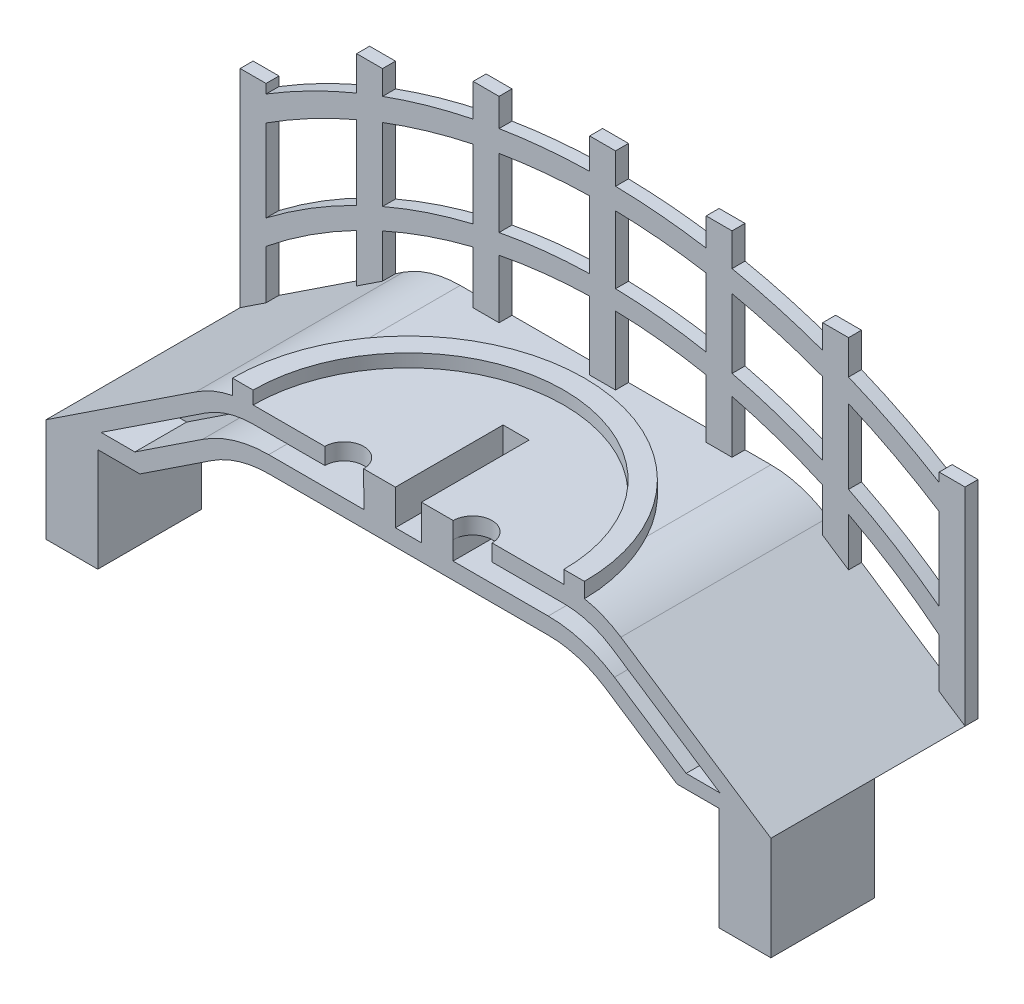
from build123d import *

# Parameters (mm, degrees)
BOSS_EXTRUDE1_DEPTH      = 12.7
BOSS_EXTRUDE2_DEPTH      = 0.79375
SKETCH5_7_W              = 1.5875
SKETCH5_7_H              = 15.875
SKETCH5_7_H_2            = 12.7
BOSS_EXTRUDE6_DEPTH      = 0.79375
BOSS_EXTRUDE7_DEPTH      = 0.79375
CUT_EXTRUDE1_DEPTH       = 9.525
SKETCH8_W                = 1.6002
SKETCH8_H                = 6.604
CUT_EXTRUDE2_DEPTH       = 1.397
BOSS_EXTRUDE8_DEPTH      = 1.397
BOSS_EXTRUDE9_DEPTH      = 0.79375
BOSS_EXTRUDE9_DEPTH_BACK = 0.254
SKETCH12_W               = 3.175
SKETCH12_H               = 6.35
BOSS_EXTRUDE10_DEPTH     = 6.35
CUT_EXTRUDE3_DEPTH       = 3.175


with BuildPart() as part:
    # Sketch5 → Boss-Extrude1 (new body)
    with BuildSketch(Plane.XY):
        with BuildLine():
            Line((5.757097876, 0), (10.152663822, 2.905998883))
            ThreePointArc((10.152663822, 2.905998883), (11.826216975, 3.690024401), (13.654645278, 3.958959532))
            Line((13.654645278, 3.958959532), (30.795354722, 3.958959532))
            ThreePointArc((30.795354722, 3.958959532), (32.623783025, 3.690024401), (34.297336178, 2.905998883))
            Line((34.297336178, 2.905998883), (38.692902124, 0))
            Line((38.692902124, 0), (44.45, 0))
            Line((44.45, 0), (35.251981456, 6.080998883))
            ThreePointArc((35.251981456, 6.080998883), (33.578428304, 6.865024401), (31.75, 7.133959532))
            Line((31.75, 7.133959532), (12.7, 7.133959532))
            ThreePointArc((12.7, 7.133959532), (10.871571696, 6.865024401), (9.198018544, 6.080998883))
            Line((9.198018544, 6.080998883), (0, 0))
            Line((0, 0), (5.757097876, 0))
        make_face()
    extrude(amount=BOSS_EXTRUDE1_DEPTH)



with BuildPart() as body_2:
    # Sketch5<4> → Boss-Extrude2 (new body)
    with BuildSketch(Plane.XY):
        with BuildLine():
            Line((0, 11.1125), (0, 9.525))
            ThreePointArc((0, 9.525), (22.225, 16.658959532), (44.45, 9.525))
            Line((44.45, 9.525), (44.45, 11.1125))
            ThreePointArc((44.45, 11.1125), (22.225, 17.96069625), (0, 11.1125))
        make_face()
    extrude(amount=BOSS_EXTRUDE2_DEPTH)

    # Sketch5<7> → Boss-Extrude6 (add)
    with BuildSketch(Plane.XY):
        with Locations((7.9375, 9.122908395)):
            Rectangle(SKETCH5_7_W, SKETCH5_7_H)
        Polygon((0, 0), (1.5875, 1.049528839), (1.5875, 12.7), (0, 12.7), align=None)
        with Locations((15.08125, 11.222301738)):
            Rectangle(SKETCH5_7_W, SKETCH5_7_H)
        with Locations((22.225, 11.896459532)):
            Rectangle(SKETCH5_7_W, SKETCH5_7_H)
        with BuildLine():
            Line((28.575, 3.284801738), (30.1625, 3.284801738))
            Line((30.1625, 3.284801738), (30.1625, 15.824904204))
            ThreePointArc((30.1625, 15.824904204), (29.370349797, 15.984497043), (28.575, 16.127292418))
            Line((28.575, 16.127292418), (28.575, 3.284801738))
        make_face()
        with BuildLine():
            Line((28.575, 19.159801738), (28.575, 17.446790716))
            ThreePointArc((28.575, 17.446790716), (29.370242514, 17.308866955), (30.1625, 17.154718663))
            Line((30.1625, 17.154718663), (30.1625, 19.159801738))
            Line((30.1625, 19.159801738), (28.575, 19.159801738))
        make_face()
        with Locations((36.5125, 9.122908395)):
            Rectangle(SKETCH5_7_W, SKETCH5_7_H)
        with Locations((43.65625, 6.35)):
            Rectangle(SKETCH5_7_W, SKETCH5_7_H_2)
    extrude(amount=BOSS_EXTRUDE6_DEPTH)


with BuildPart() as part_1:
    add(part.part)

    add(body_2.part)  # Boss-Extrude7 merges body 2
    # Sketch6 → Boss-Extrude7 (add)
    with BuildSketch(Plane(origin=(0, 0, 0), x_dir=(-1, 0, 0), z_dir=(0, 0, -1))):
        with BuildLine():
            Line((-44.45, 4.270423014), (-44.45, 2.682923014))
            ThreePointArc((-44.45, 2.682923014), (-22.225, 11.337252313), (0, 2.682923014))
            Line((0, 2.682923014), (0, 4.270423014))
            ThreePointArc((0, 4.270423014), (-22.225, 12.523643082), (-44.45, 4.270423014))
        make_face()
    extrude(amount=-BOSS_EXTRUDE7_DEPTH)

    # Sketch7 → Cut-Extrude1 (cut)
    with BuildSketch(Plane.XY.offset(12.7)):
        Polygon((31.75, 6.117959532), (12.7, 6.117959532), (12.7, 4.974959532), (13.654645278, 4.974959532), (30.795354722, 4.974959532), (31.75, 4.974959532), align=None)
    extrude(amount=-CUT_EXTRUDE1_DEPTH, mode=Mode.SUBTRACT)

    # Sketch8 → Cut-Extrude2 (cut)
    with BuildSketch(Plane(origin=(0, 7.133959532, 0), x_dir=(1, 0, 0), z_dir=(0, 1, 0))):
        with BuildLine():
            Line((17.097375, -12.7), (19.478625, -12.7))
            ThreePointArc((19.478625, -12.7), (18.288, -11.509375), (17.097375, -12.7))
        make_face()
        with BuildLine():
            ThreePointArc((27.352625, -12.7), (26.162, -11.509375), (24.971375, -12.7))
            Line((24.971375, -12.7), (27.352625, -12.7))
        make_face()
        with Locations((22.225, -9.398)):
            Rectangle(SKETCH8_W, SKETCH8_H)
    extrude(amount=-CUT_EXTRUDE2_DEPTH, mode=Mode.SUBTRACT)

    # Sketch10 → Boss-Extrude8 (add)
    with BuildSketch(Plane(origin=(0, 4.974959532, 0), x_dir=(1, 0, 0), z_dir=(0, 1, 0))):
        Polygon((19.488784942, -5.496745829), (19.488784942, -12.7), (21.4249, -12.7), (21.4249, -6.096), (23.0251, -6.096), (23.0251, -12.7), (24.961215058, -12.7), (24.961215058, -5.496745829), align=None)
    extrude(amount=BOSS_EXTRUDE8_DEPTH)

    # Sketch11 → Boss-Extrude9 (add, two sides: drawn at the far end of the back side and taken through both)
    with BuildSketch(Plane(origin=(0, 7.133959532, 0), x_dir=(1, 0, 0), z_dir=(0, 1, 0)).offset(-BOSS_EXTRUDE9_DEPTH_BACK)):
        with BuildLine():
            Line((11.43, -12.7), (12.7, -12.7))
            ThreePointArc((12.7, -12.7), (22.225, -3.175), (31.75, -12.7))
            Line((31.75, -12.7), (33.02, -12.7))
            ThreePointArc((33.02, -12.7), (22.225, -1.905), (11.43, -12.7))
        make_face()
    extrude(amount=BOSS_EXTRUDE9_DEPTH + BOSS_EXTRUDE9_DEPTH_BACK)

    # Sketch12 → Boss-Extrude10 (add)
    with BuildSketch(Plane.XZ):
        with Locations((1.5875, 9.525)):
            Rectangle(SKETCH12_W, SKETCH12_H)
        with Locations((42.8625, 9.525)):
            Rectangle(SKETCH12_W, SKETCH12_H)
    extrude(amount=BOSS_EXTRUDE10_DEPTH)

    # Sketch7<4> → Cut-Extrude3 (cut)
    with BuildSketch(Plane.XY.offset(12.7)):
        with BuildLine():
            Line((12.7, 4.974959532), (12.7, 6.117959532))
            ThreePointArc((12.7, 6.117959532), (11.164120225, 5.892054022), (9.758335577, 5.233472586))
            Line((9.758335577, 5.233472586), (3.379056151, 1.016))
            Line((3.379056151, 1.016), (5.451611386, 1.016))
            Line((5.451611386, 1.016), (9.592346789, 3.753525179))
            ThreePointArc((9.592346789, 3.753525179), (11.533668446, 4.66299478), (13.654645278, 4.974959532))
            Line((13.654645278, 4.974959532), (12.7, 4.974959532))
        make_face()
        with BuildLine():
            ThreePointArc((34.691664423, 5.233472586), (33.285879775, 5.892054022), (31.75, 6.117959532))
            Line((31.75, 6.117959532), (31.75, 4.974959532))
            Line((31.75, 4.974959532), (30.795354722, 4.974959532))
            ThreePointArc((30.795354722, 4.974959532), (32.916331554, 4.66299478), (34.857653211, 3.753525179))
            Line((34.857653211, 3.753525179), (39.253219157, 0.847526296))
            Line((39.253219157, 0.847526296), (41.325774393, 0.847526296))
            Line((41.325774393, 0.847526296), (34.691664423, 5.233472586))
        make_face()
    extrude(amount=-CUT_EXTRUDE3_DEPTH, mode=Mode.SUBTRACT)


solid = part_1.part
